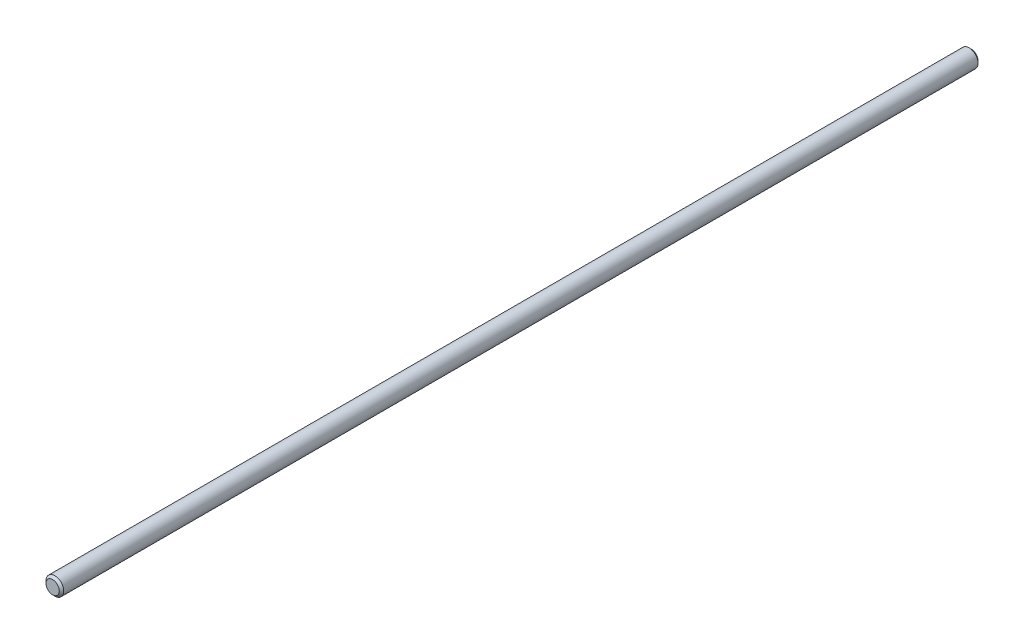
from build123d import *

# Parameters (mm, degrees)
SCHIZZO1_R                   = 4
ESTRUSIONE_ESTRUSIONE1_DEPTH = 415
SMUSSO1_SIZE                 = 1


with BuildPart() as part:
    # Schizzo1 → Estrusione-Estrusione1 (new body)
    with BuildSketch(Plane.XY):
        Circle(SCHIZZO1_R)
    extrude(amount=ESTRUSIONE_ESTRUSIONE1_DEPTH)

    # Smusso1
    smusso1_edges = [part.edges().sort_by_distance(p)[0] for p in [
        (-4, 0, 0),
        (-4, 0, 415),
    ]]
    chamfer(smusso1_edges, length=SMUSSO1_SIZE)


solid = part.part
